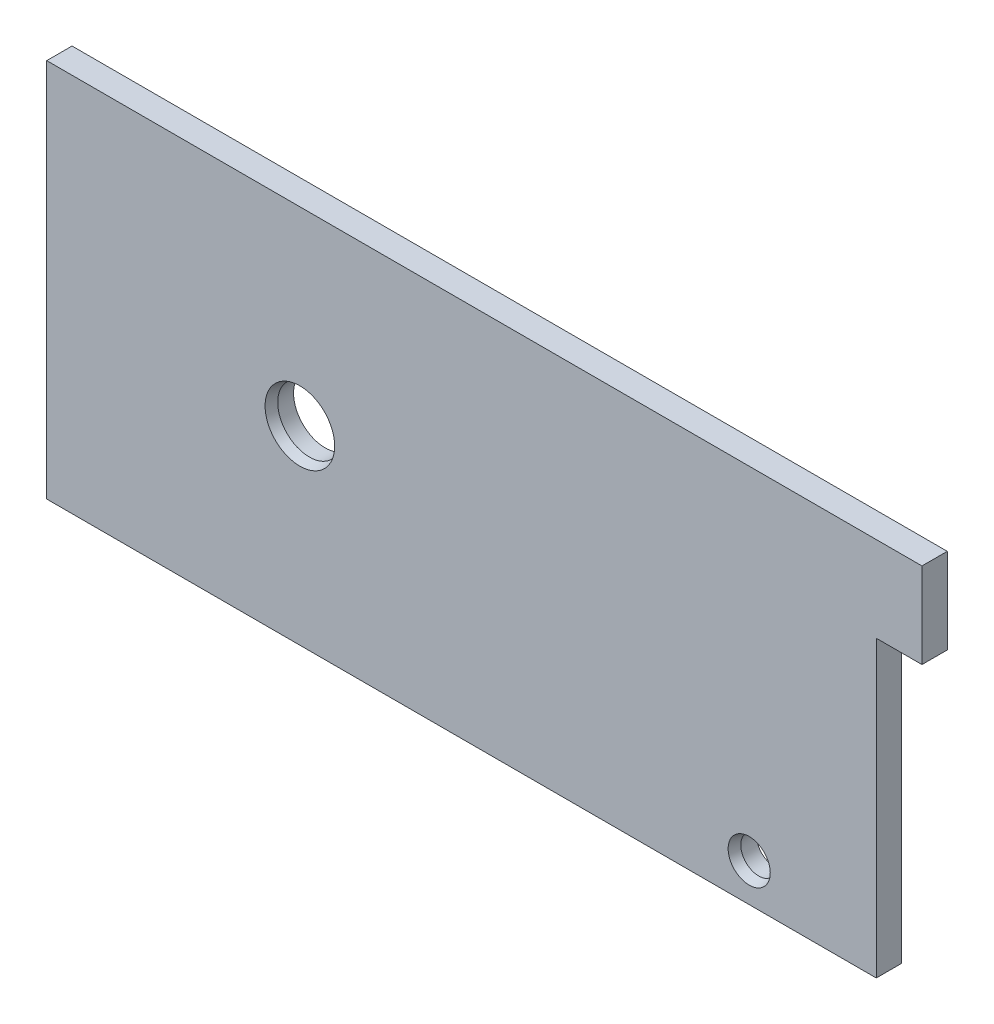
from build123d import *

# Parameters (mm, degrees)
SKETCH1_R           = 5
SKETCH1_R_2         = 2.83
BOSS_EXTRUDE1_DEPTH = 2
CHAMFER1_SIZE       = 0.5
CHAMFER1_SIZE2      = 1.5


with BuildPart() as part:
    # Sketch1 → Boss-Extrude1 (new, symmetric)
    with BuildSketch(Plane.XY):
        Polygon((-81, -30), (50.07973639, -30), (50.07973639, 16.5), (57.3, 16.5), (57.3, 30), (-81, 30), align=None)
        with Locations((-41, 0)):
            Circle(SKETCH1_R, mode=Mode.SUBTRACT)
        with Locations((30, -24)):
            Circle(SKETCH1_R_2, mode=Mode.SUBTRACT)
    extrude(amount=BOSS_EXTRUDE1_DEPTH, both=True)

    # Chamfer1
    chamfer1_edges = [part.edges().sort_by_distance(p)[0] for p in [
        (27.17, -24, 2),
        (-46, 0, 2),
    ]]
    chamfer1_side = [part.faces().sort_by_distance(p)[0] for p in [
        (-14.492729758, 0.365221884, 2),
    ]]
    chamfer(chamfer1_edges, length=CHAMFER1_SIZE, length2=CHAMFER1_SIZE2, reference=chamfer1_side[0])


solid = part.part
